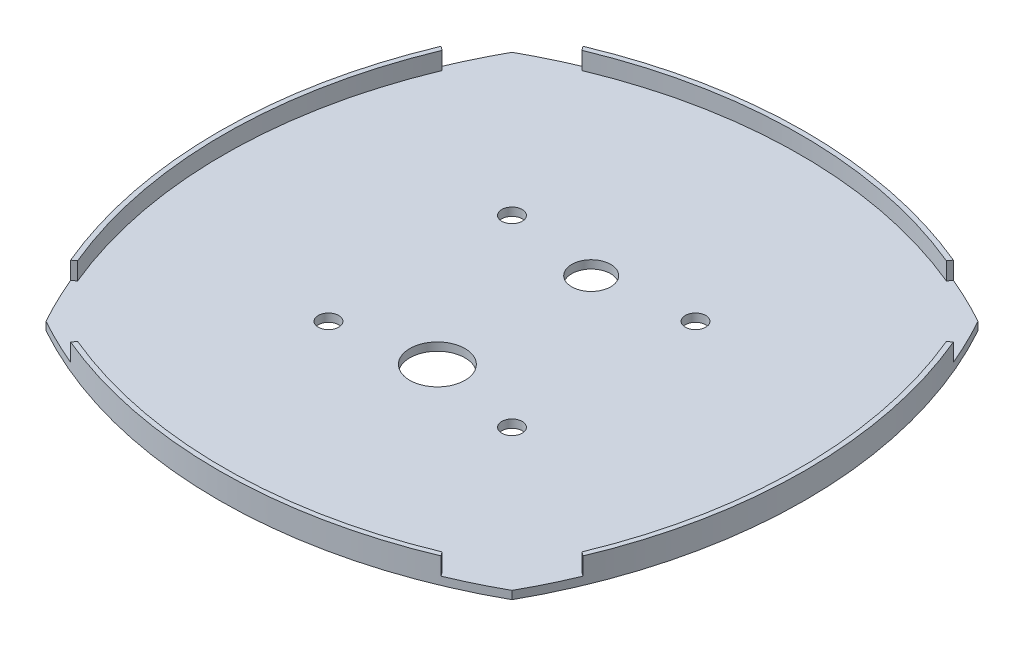
from build123d import *

# Parameters (mm, degrees)
BOSS_EXTRUDE1_DEPTH     = 2.5
BOSS_EXTRUDE2_DEPTH     = 5.4
CUT_EXTRUDE2_DEPTH      = 324.312541101
CUT_EXTRUDE2_DEPTH_BACK = 324.312541101
SKETCH11_R              = 3.15
SKETCH11_R_2            = 8.5
SKETCH11_R_3            = 6


with BuildPart() as part:
    # Sketch3 → Boss-Extrude1 (new body)
    with BuildSketch(Plane(origin=(0, 0, 0), x_dir=(1, 0, 0), z_dir=(0, 1, 0))):
        with BuildLine():
            ThreePointArc((271.153533245, 18.921159404), (199.331937646, 37.525228411), (127.510342047, 18.921159404))
            ThreePointArc((127.510342047, 18.921159404), (108.90627304, -52.900436194), (127.510342047, -124.722031793))
            ThreePointArc((127.510342047, -124.722031793), (199.331937646, -143.3261008), (271.153533245, -124.722031793))
            ThreePointArc((271.153533245, -124.722031793), (289.757602252, -52.900436194), (271.153533245, 18.921159404))
        make_face()
    extrude(amount=BOSS_EXTRUDE1_DEPTH)

    # Sketch5 → Boss-Extrude2 (add)
    with BuildSketch(Plane(origin=(0, 2.5, 0), x_dir=(1, 0, 0), z_dir=(0, 1, 0))):
        with BuildLine():
            Line((121.611565862, -109.080289564), (120.36423024, -109.98653194))
            ThreePointArc((120.36423024, -109.98653194), (108.906273045, -52.899217103), (120.365171108, 4.187908885))
            Line((120.365171108, 4.187908885), (121.612501818, 3.281670078))
            ThreePointArc((121.612501818, 3.281670078), (110.406273045, -52.899216401), (121.611565862, -109.080289564))
        make_face()
        with BuildLine():
            Line((143.152084277, -130.620807978), (142.2458419, -131.8681436))
            ThreePointArc((142.2458419, -131.8681436), (199.331937646, -143.3261008), (256.418033392, -131.8681436))
            Line((256.418033392, -131.8681436), (255.511791015, -130.620807978))
            ThreePointArc((255.511791015, -130.620807978), (199.331937646, -141.8261008), (143.152084277, -130.620807978))
        make_face()
        with BuildLine():
            Line((277.052309429, 3.279417175), (278.299645052, 4.185659552))
            ThreePointArc((278.299645052, 4.185659552), (289.757602252, -52.900436194), (278.299645052, -109.98653194))
            Line((278.299645052, -109.98653194), (277.052309429, -109.080289564))
            ThreePointArc((277.052309429, -109.080289564), (288.257602252, -52.900436194), (277.052309429, 3.279417175))
        make_face()
        with BuildLine():
            Line((255.511791015, 24.819935589), (256.418033392, 26.067271212))
            ThreePointArc((256.418033392, 26.067271212), (199.330718555, 37.525228406), (142.243592567, 26.066330343))
            Line((142.243592567, 26.066330343), (143.149831374, 24.818999633))
            ThreePointArc((143.149831374, 24.818999633), (199.330717853, 36.025228406), (255.511791015, 24.819935589))
        make_face()
    extrude(amount=BOSS_EXTRUDE2_DEPTH)

    # Sketch11 → Cut-Extrude2 (cut, two sides: drawn at the far end of the back side and taken through both)
    with BuildSketch(Plane(origin=(0, 2.5, 0), x_dir=(1, 0, 0), z_dir=(0, 1, 0)).offset(-CUT_EXTRUDE2_DEPTH_BACK)):
        with Locations((171.047666398, -24.616164947)):
            Circle(SKETCH11_R)
        with Locations((227.616208893, -24.616164947)):
            Circle(SKETCH11_R)
        with Locations((227.616208893, -81.184707442)):
            Circle(SKETCH11_R)
        with Locations((171.047666398, -81.184707442)):
            Circle(SKETCH11_R)
        with Locations((199.331937646, -75.900436194)):
            Circle(SKETCH11_R_2)
        with Locations((199.331937646, -28.482740517)):
            Circle(SKETCH11_R_3)
    extrude(amount=CUT_EXTRUDE2_DEPTH + CUT_EXTRUDE2_DEPTH_BACK, mode=Mode.SUBTRACT)


solid = part.part
